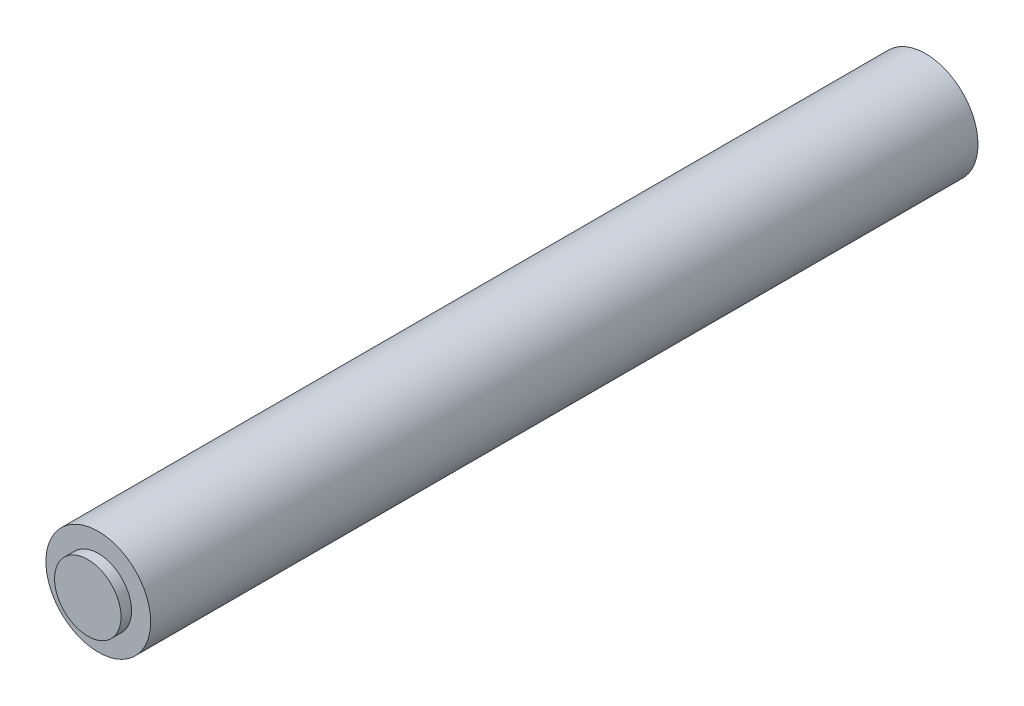
from build123d import *

# Parameters (mm, degrees)
SKETCH1_R           = 3.175
BOSS_EXTRUDE1_DEPTH = 40.5
SKETCH2_R           = 5
BOSS_EXTRUDE2_DEPTH = 39.5


with BuildPart() as part:
    # Sketch1 → Boss-Extrude1 (new, symmetric)
    with BuildSketch(Plane.XY):
        Circle(SKETCH1_R)
    extrude(amount=BOSS_EXTRUDE1_DEPTH, both=True)


with BuildPart() as body_2:
    # Sketch2 → Boss-Extrude2 (new, symmetric)
    with BuildSketch(Plane.XY):
        Circle(SKETCH2_R)
    extrude(amount=BOSS_EXTRUDE2_DEPTH, both=True)


solid = Compound([part.part, body_2.part])
